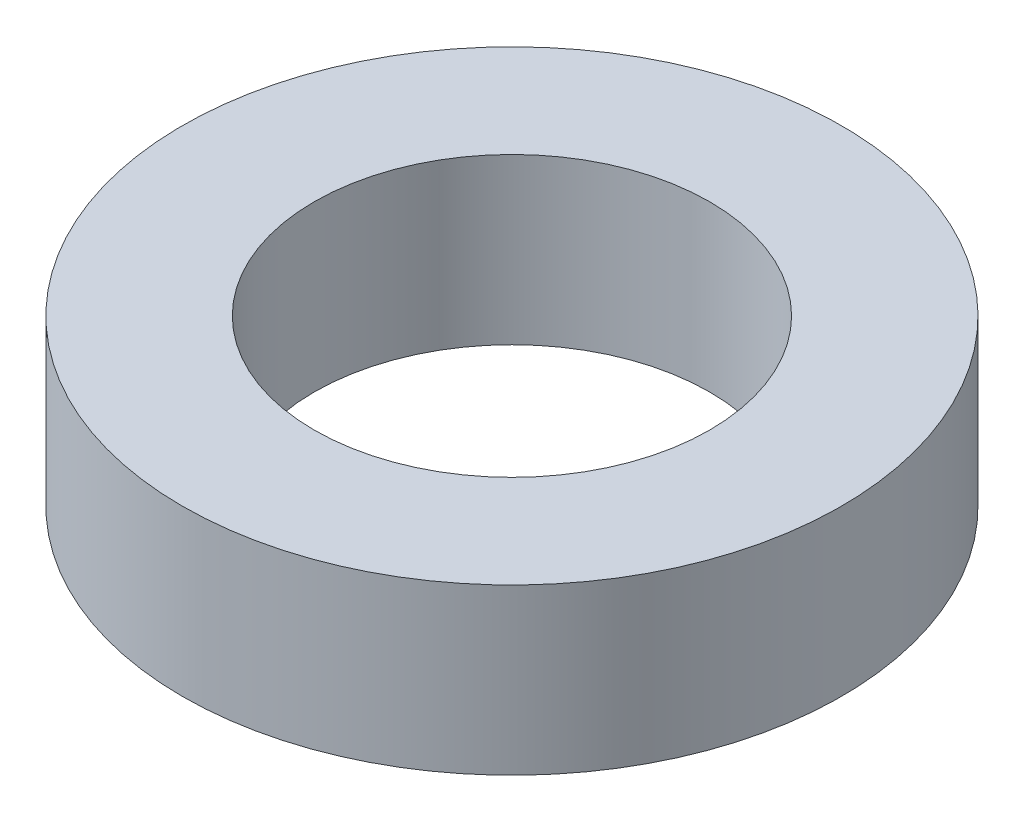
from build123d import *

# Parameters (mm, degrees)
SKETCH1_R           = 50
BOSS_EXTRUDE1_DEPTH = 25
SKETCH2_R           = 30
CUT_EXTRUDE1_DEPTH  = 76


with BuildPart() as part:
    # Sketch1 → Boss-Extrude1 (new body)
    with BuildSketch(Plane(origin=(0, 0, 0), x_dir=(1, 0, 0), z_dir=(0, 1, 0))):
        Circle(SKETCH1_R)
    extrude(amount=BOSS_EXTRUDE1_DEPTH)

    # Sketch2 → Cut-Extrude1 (cut, through all)
    with BuildSketch(Plane(origin=(0, 0, 0), x_dir=(1, 0, 0), z_dir=(0, 1, 0))):
        Circle(SKETCH2_R)
    extrude(amount=CUT_EXTRUDE1_DEPTH, mode=Mode.SUBTRACT)


solid = part.part
